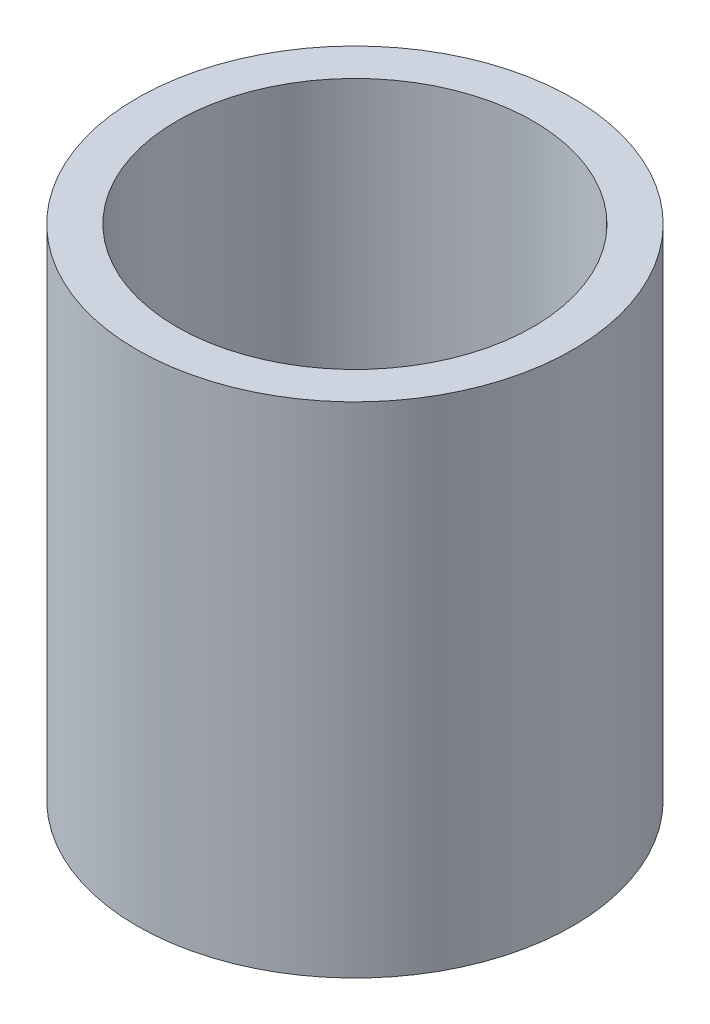
from build123d import *

# Parameters (mm, degrees)
SKETCH1_R           = 15
BOSS_EXTRUDE1_DEPTH = 34.340366101
SKETCH2_R           = 12.267080776
CUT_EXTRUDE1_DEPTH  = 41.364102169


with BuildPart() as part:
    # Sketch1 → Boss-Extrude1 (new body)
    with BuildSketch(Plane(origin=(0, 0, 0), x_dir=(1, 0, 0), z_dir=(0, 1, 0))):
        Circle(SKETCH1_R)
    extrude(amount=BOSS_EXTRUDE1_DEPTH)

    # Sketch2 → Cut-Extrude1 (cut, through all)
    with BuildSketch(Plane(origin=(0, 0, 0), x_dir=(1, 0, 0), z_dir=(0, 1, 0))):
        Circle(SKETCH2_R)
    extrude(amount=CUT_EXTRUDE1_DEPTH, mode=Mode.SUBTRACT)


solid = part.part
